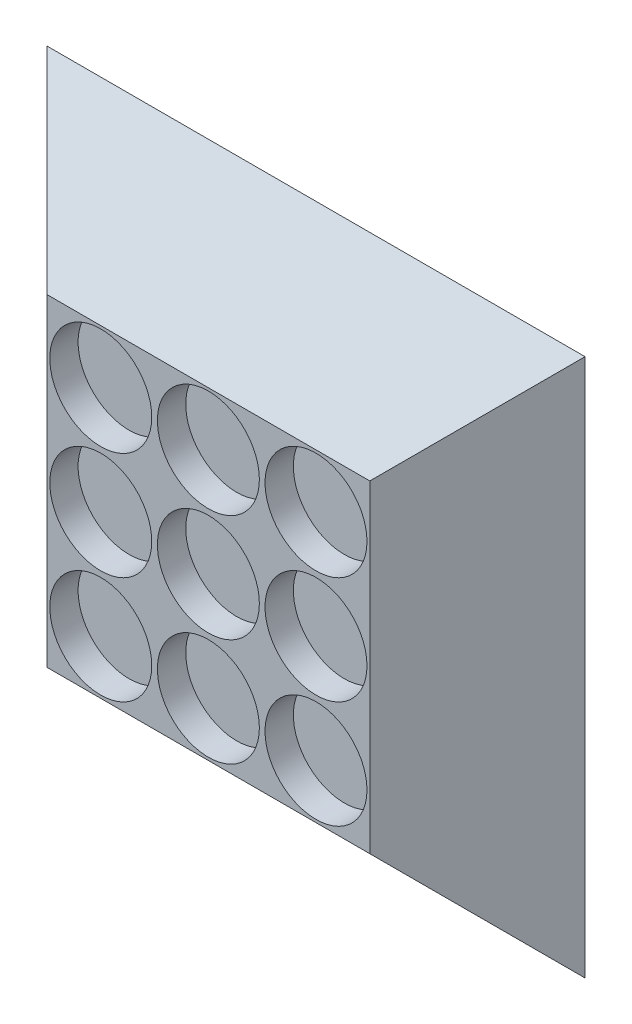
from build123d import *

# Parameters (mm, degrees)
SKETCH_1_W          = 95
SKETCH_1_H          = 95
EXTRUDE_1_DEPTH     = 19
CHAMFER_1_SIZE      = 19
SKETCH_2_R          = 9
CUT_EXTRUDE_1_DEPTH = 5


with BuildPart() as part:
    # Эскиз1 → Бобышка-Вытянуть1 (new body)
    with BuildSketch(Plane.XY):
        Rectangle(SKETCH_1_W, SKETCH_1_H)
    extrude(amount=EXTRUDE_1_DEPTH)

    # Фаска1
    chamfer_1_edges = [part.edges().sort_by_distance(p)[0] for p in [
        (0, 47.5, 19),
        (47.5, 0, 19),
        (0, -47.5, 19),
        (-47.5, 0, 19),
    ]]
    chamfer(chamfer_1_edges, length=CHAMFER_1_SIZE - 0.0001)  # a hair under: the kernel refuses the full size

    # Эскиз2 → Вырез-Вытянуть1 (cut)
    with BuildSketch(Plane.XY.offset(19)):
        Circle(SKETCH_2_R)
        with Locations((19, 0)):
            Circle(SKETCH_2_R)
        with Locations((19, 19)):
            Circle(SKETCH_2_R)
        with Locations((0, 19)):
            Circle(SKETCH_2_R)
        with Locations((-19, 19)):
            Circle(SKETCH_2_R)
        with Locations((-19, 0)):
            Circle(SKETCH_2_R)
        with Locations((-19, -19)):
            Circle(SKETCH_2_R)
        with Locations((0, -19)):
            Circle(SKETCH_2_R)
        with Locations((19, -19)):
            Circle(SKETCH_2_R)
    extrude(amount=-CUT_EXTRUDE_1_DEPTH, mode=Mode.SUBTRACT)


solid = part.part
